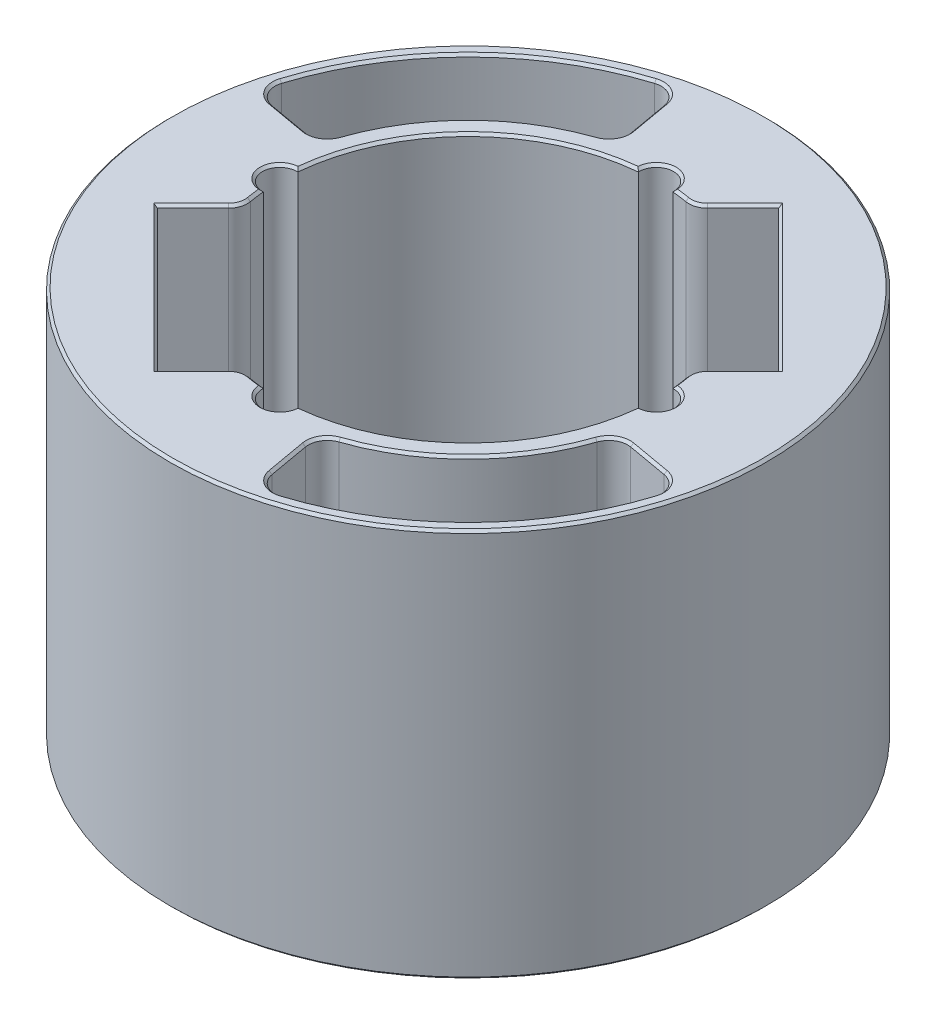
from build123d import *

# Parameters (mm, degrees)
SKETCH2_R           = 47.5
BOSS_EXTRUDE2_DEPTH = 31
CUT_EXTRUDE1_DEPTH  = 92.413893911
CUT_EXTRUDE3_DEPTH  = 92.413893911
FILLET1_R           = 3
CHAMFER1_SIZE       = 0.4


with BuildPart() as part:
    # Sketch2 → Boss-Extrude2 (new, symmetric)
    with BuildSketch(Plane(origin=(0, 0, 0), x_dir=(1, 0, 0), z_dir=(0, 1, 0))):
        Circle(SKETCH2_R)
        with BuildLine():
            ThreePointArc((29.873958333, 2.747110027), (21.213203436, 21.213203436), (2.747110027, 29.873958333))
            ThreePointArc((2.747110027, 29.873958333), (0, 32.75), (-2.747110027, 29.873958333))
            ThreePointArc((-2.747110027, 29.873958333), (-21.213203436, 21.213203436), (-29.873958333, 2.747110027))
            ThreePointArc((-29.873958333, 2.747110027), (-32.75, 0), (-29.873958333, -2.747110027))
            ThreePointArc((-29.873958333, -2.747110027), (-21.213203436, -21.213203436), (-2.747110027, -29.873958333))
            ThreePointArc((-2.747110027, -29.873958333), (0, -32.75), (2.747110027, -29.873958333))
            ThreePointArc((2.747110027, -29.873958333), (21.213203436, -21.213203436), (29.873958333, -2.747110027))
            ThreePointArc((29.873958333, -2.747110027), (32.75, 0), (29.873958333, 2.747110027))
        make_face(mode=Mode.SUBTRACT)
    extrude(amount=BOSS_EXTRUDE2_DEPTH, both=True)

    # Sketch4 → Cut-Extrude1 (cut, through all)
    with BuildSketch(Plane(origin=(0, 31, 0), x_dir=(1, 0, 0), z_dir=(0, 1, 0))):
        Polygon((4.949747468, 27.577164466), (27.577164466, 4.949747468), (36.062445841, 13.435028843), (13.435028843, 36.062445841), align=None)
        Polygon((-36.062445841, -13.435028843), (-13.435028843, -36.062445841), (-4.949747468, -27.577164466), (-27.577164466, -4.949747468), align=None)
    extrude(amount=-CUT_EXTRUDE1_DEPTH, mode=Mode.SUBTRACT)

    # Sketch6 → Cut-Extrude3 (cut, through all)
    with BuildSketch(Plane.XZ.offset(31)):
        with BuildLine():
            ThreePointArc((-8.215340775, -31.961041534), (-23.334523779, -23.334523779), (-31.961041534, -8.215340775))
            Line((-31.961041534, -8.215340775), (-44.297685425, -10.390623944))
            ThreePointArc((-44.297685425, -10.390623944), (-32.173358544, -32.173358544), (-10.390623944, -44.297685425))
            Line((-10.390623944, -44.297685425), (-8.215340775, -31.961041534))
        make_face()
        with BuildLine():
            ThreePointArc((44.297685425, 10.390623944), (32.173358544, 32.173358544), (10.390623944, 44.297685425))
            Line((10.390623944, 44.297685425), (8.215340775, 31.961041534))
            ThreePointArc((8.215340775, 31.961041534), (23.334523779, 23.334523779), (31.961041534, 8.215340775))
            Line((31.961041534, 8.215340775), (44.297685425, 10.390623944))
        make_face()
    extrude(amount=-CUT_EXTRUDE3_DEPTH, mode=Mode.SUBTRACT)

    # Fillet1
    fillet1_edges = [part.edges().sort_by_distance(p)[0] for p in [
        (6.630649946, 0, -29.258066944),
        (-29.258066944, 0, 6.630649946),
        (-6.630649946, 0, 29.258066944),
        (29.258066944, 0, -6.630649946),
        (10.390623944, 0, 44.297685425),
        (8.215340775, 0, 31.961041534),
        (31.961041534, 0, 8.215340775),
        (44.297685425, 0, 10.390623944),
        (-10.390623944, 0, -44.297685425),
        (-8.215340775, 0, -31.961041534),
        (-44.297685425, 0, -10.390623944),
        (-31.961041534, 0, -8.215340775),
    ]]
    fillet(fillet1_edges, radius=FILLET1_R)

    # Chamfer1
    chamfer1_edges = [part.edges().sort_by_distance(p)[0] for p in [
        (-47.5, 31, 0),
        (0, 31, -32.75),
        (-21.213203436, 31, -21.213203436),
        (-32.75, 31, 0),
        (-29.739874323, 31, 3.942064843),
        (-29.653866707, 31, 6.549684508),
        (-33.227469184, 31, 10.600052186),
        (-24.748737342, 31, 24.748737342),
        (-10.600052186, 31, 33.227469184),
        (-6.549684508, 31, 29.653866707),
        (-3.942064843, 31, 29.739874323),
        (0, 31, 32.75),
        (21.213203436, 31, 21.213203436),
        (32.75, 31, 0),
        (29.739874323, 31, -3.942064843),
        (29.653866707, 31, -6.549684508),
        (33.227469184, 31, -10.600052186),
        (24.748737342, 31, -24.748737342),
        (10.600052186, 31, -33.227469184),
        (6.549684508, 31, -29.653866707),
        (3.942064843, 31, -29.739874323),
        (9.050300179, 31, 32.542651331),
        (9.24891807, 31, 37.822749654),
        (11.216919994, 31, 43.099644746),
        (32.173358544, 31, 32.173358544),
        (43.099644746, 31, 11.216919994),
        (37.822749654, 31, 9.24891807),
        (32.542651331, 31, 9.050300179),
        (23.334523779, 31, 23.334523779),
        (-9.050300179, 31, -32.542651331),
        (-9.24891807, 31, -37.822749654),
        (-11.216919994, 31, -43.099644746),
        (-32.173358544, 31, -32.173358544),
        (-43.099644746, 31, -11.216919994),
        (-37.822749654, 31, -9.24891807),
        (-32.542651331, 31, -9.050300179),
        (-23.334523779, 31, -23.334523779),
        (-47.5, -31, 0),
        (24.748737342, -31, -24.748737342),
        (33.227469184, -31, -10.600052186),
        (29.653866707, -31, -6.549684508),
        (29.739874323, -31, -3.942064843),
        (32.75, -31, 0),
        (21.213203436, -31, 21.213203436),
        (0, -31, 32.75),
        (-3.942064843, -31, 29.739874323),
        (-6.549684508, -31, 29.653866707),
        (-10.600052186, -31, 33.227469184),
        (-24.748737342, -31, 24.748737342),
        (-33.227469184, -31, 10.600052186),
        (-29.653866707, -31, 6.549684508),
        (-29.739874323, -31, 3.942064843),
        (-32.75, -31, 0),
        (-21.213203436, -31, -21.213203436),
        (0, -31, -32.75),
        (3.942064843, -31, -29.739874323),
        (6.549684508, -31, -29.653866707),
        (10.600052186, -31, -33.227469184),
        (11.216919994, -31, 43.099644746),
        (9.24891807, -31, 37.822749654),
        (9.050300179, -31, 32.542651331),
        (23.334523779, -31, 23.334523779),
        (32.542651331, -31, 9.050300179),
        (37.822749654, -31, 9.24891807),
        (43.099644746, -31, 11.216919994),
        (32.173358544, -31, 32.173358544),
        (-11.216919994, -31, -43.099644746),
        (-9.24891807, -31, -37.822749654),
        (-9.050300179, -31, -32.542651331),
        (-23.334523779, -31, -23.334523779),
        (-32.542651331, -31, -9.050300179),
        (-37.822749654, -31, -9.24891807),
        (-43.099644746, -31, -11.216919994),
        (-32.173358544, -31, -32.173358544),
    ]]
    chamfer(chamfer1_edges, length=CHAMFER1_SIZE)


solid = part.part
